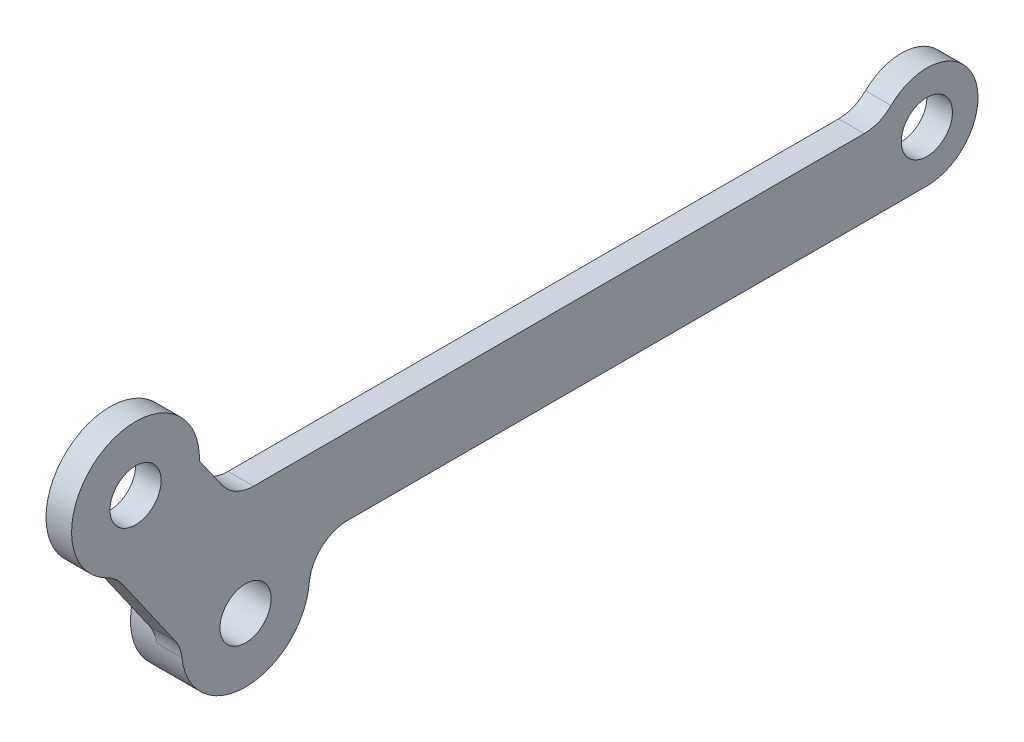
from build123d import *

# Parameters (mm, degrees)
EXTRUDE_1_DEPTH          = 2
EXTRUDE_START            = -2
SKETCH_1_4_R             = 5
EXTRUDE_2_DEPTH          = 2
CUT_EXTRUDE_1_DEPTH      = 60.733771951
CUT_EXTRUDE_1_DEPTH_BACK = 60.733771951
SKETCH_1_3_R             = 2
FILLET_1_R               = 3


with BuildPart() as part:
    # 草图1 → 凸台-拉伸1 (new body)
    with BuildSketch(Plane(origin=(0, 0, 0), x_dir=(0, 0, -1), z_dir=(1, 0, 0))):
        with BuildLine():
            Line((50.737143614, 0), (0, 0))
            Line((0, 0), (2.48051592, -3.542543867))
            ThreePointArc((2.48051592, -3.542543867), (4.165783411, -4.487079684), (5.367176995, -6))
            Line((5.367176995, -6), (54.201245229, -6))
            ThreePointArc((54.201245229, -6), (50.737143614, -4), (50.737143614, 0))
        make_face()
        with BuildLine():
            Line((2.48051592, -3.542543867), (0, 0))
            Line((0, 0), (-2.681672007, 3.829824531))
            ThreePointArc((-2.681672007, 3.829824531), (-4.811127311, -0.102785303), (-9.234888361, -0.758786959))
            Line((-9.234888361, -0.758786959), (-4.072700434, -8.131155358))
            ThreePointArc((-4.072700434, -8.131155358), (-1.94324513, -4.198545524), (2.48051592, -3.542543867))
        make_face()
        with BuildLine():
            ThreePointArc((58.201245229, -2), (55.23652141, 1.863703305), (50.737143614, 0))
            Line((50.737143614, 0), (54.201245229, 0))
            ThreePointArc((54.201245229, 0), (55.615458792, -0.585786438), (56.201245229, -2))
            ThreePointArc((56.201245229, -2), (55.615458792, -3.414213562), (54.201245229, -4))
            Line((54.201245229, -4), (54.201245229, -6))
            ThreePointArc((54.201245229, -6), (57.029672354, -4.828427125), (58.201245229, -2))
        make_face()
        with BuildLine():
            Line((54.201245229, 0), (50.737143614, 0))
            ThreePointArc((50.737143614, 0), (50.737143614, -4), (54.201245229, -6))
            Line((54.201245229, -6), (54.201245229, -4))
            ThreePointArc((54.201245229, -4), (52.201245229, -2), (54.201245229, 0))
        make_face()
        with BuildLine():
            ThreePointArc((5.367176995, -6), (4.165783411, -4.487079684), (2.48051592, -3.542543867))
            Line((2.48051592, -3.542543867), (4.201245229, -6))
            Line((4.201245229, -6), (5.367176995, -6))
        make_face()
        with BuildLine():
            Line((4.201245229, -6), (2.48051592, -3.542543867))
            ThreePointArc((2.48051592, -3.542543867), (-1.94324513, -4.198545524), (-4.072700434, -8.131155358))
            Line((-4.072700434, -8.131155358), (-2.351971125, -10.588611491))
            Line((-2.351971125, -10.588611491), (-0.713667036, -9.441458618))
            ThreePointArc((-0.713667036, -9.441458618), (-0.222515821, -6.656001657), (2.562941141, -7.147152873))
            Line((2.562941141, -7.147152873), (4.201245229, -6))
        make_face()
        with BuildLine():
            ThreePointArc((-9.234888361, -0.758786959), (-4.811127311, -0.102785303), (-2.681672007, 3.829824531))
            Line((-2.681672007, 3.829824531), (-4.402401316, 6.287280664))
            Line((-4.402401316, 6.287280664), (-6.040705405, 5.140127792))
            ThreePointArc((-6.040705405, 5.140127792), (-5.771575592, 4.594386518), (-5.679009493, 3.992974919))
            ThreePointArc((-5.679009493, 3.992974919), (-7.077597894, 2.085541017), (-9.317313582, 2.845822046))
            Line((-9.317313582, 2.845822046), (-10.95561767, 1.698669174))
            Line((-10.95561767, 1.698669174), (-9.234888361, -0.758786959))
        make_face()
        with BuildLine():
            Line((-4.402401316, 6.287280664), (-2.681672007, 3.829824531))
            ThreePointArc((-2.681672007, 3.829824531), (-2.679675166, 3.911388863), (-2.679009493, 3.992974919))
            ThreePointArc((-2.679009493, 3.992974919), (-10.613341245, 8.041394014), (-9.234888361, -0.758786959))
            Line((-9.234888361, -0.758786959), (-10.95561767, 1.698669174))
            Line((-10.95561767, 1.698669174), (-9.317313582, 2.845822046))
            ThreePointArc((-9.317313582, 2.845822046), (-8.826162366, 5.631279008), (-6.040705405, 5.140127792))
            Line((-6.040705405, 5.140127792), (-4.402401316, 6.287280664))
        make_face()
        with BuildLine():
            ThreePointArc((56.201245229, -2), (55.615458792, -0.585786438), (54.201245229, 0))
            Line((54.201245229, 0), (54.201245229, -4))
            ThreePointArc((54.201245229, -4), (55.615458792, -3.414213562), (56.201245229, -2))
        make_face()
        with BuildLine():
            Line((54.201245229, -4), (54.201245229, 0))
            ThreePointArc((54.201245229, 0), (52.201245229, -2), (54.201245229, -4))
        make_face()
        with BuildLine():
            Line((5.367176995, -6), (4.201245229, -6))
            Line((4.201245229, -6), (2.562941141, -7.147152873))
            ThreePointArc((2.562941141, -7.147152873), (2.832070954, -7.692894146), (2.924637052, -8.294305745))
            ThreePointArc((2.924637052, -8.294305745), (1.526048651, -10.201739647), (-0.713667036, -9.441458618))
            Line((-0.713667036, -9.441458618), (-2.351971125, -10.588611491))
            Line((-2.351971125, -10.588611491), (-4.072700434, -8.131155358))
            ThreePointArc((-4.072700434, -8.131155358), (0.843050996, -13.293640073), (5.924637052, -8.294305745))
            ThreePointArc((5.924637052, -8.294305745), (5.783273678, -7.113776143), (5.367176995, -6))
        make_face()
        with BuildLine():
            ThreePointArc((2.924637052, -8.294305745), (2.832070954, -7.692894146), (2.562941141, -7.147152873))
            Line((2.562941141, -7.147152873), (-0.713667036, -9.441458618))
            ThreePointArc((-0.713667036, -9.441458618), (1.526048651, -10.201739647), (2.924637052, -8.294305745))
        make_face()
        with BuildLine():
            Line((-0.713667036, -9.441458618), (2.562941141, -7.147152873))
            ThreePointArc((2.562941141, -7.147152873), (-0.222515821, -6.656001657), (-0.713667036, -9.441458618))
        make_face()
        with BuildLine():
            ThreePointArc((-5.679009493, 3.992974919), (-5.771575592, 4.594386518), (-6.040705405, 5.140127792))
            Line((-6.040705405, 5.140127792), (-9.317313582, 2.845822046))
            ThreePointArc((-9.317313582, 2.845822046), (-7.077597894, 2.085541017), (-5.679009493, 3.992974919))
        make_face()
        with BuildLine():
            Line((-9.317313582, 2.845822046), (-6.040705405, 5.140127792))
            ThreePointArc((-6.040705405, 5.140127792), (-8.826162366, 5.631279008), (-9.317313582, 2.845822046))
        make_face()
    extrude(amount=EXTRUDE_1_DEPTH)

    # 草图1<4> → 凸台-拉伸2 (add)
    with BuildSketch(Plane(origin=(0, 0, 0), x_dir=(0, 0, -1), z_dir=(1, 0, 0)).offset(EXTRUDE_START)):
        with Locations(Location((0.924637052, -8.294305745, 0), (0, 0, 178.130102354))):
            Circle(SKETCH_1_4_R)
    extrude(amount=EXTRUDE_2_DEPTH)

    # 草图1<3> → 切除-拉伸1 (cut, two sides: drawn at the far end of the back side and taken through both)
    with BuildSketch(Plane(origin=(0, 0, 0), x_dir=(0, 0, -1), z_dir=(1, 0, 0)).offset(-CUT_EXTRUDE_1_DEPTH_BACK)):
        with Locations((-7.679009493, 3.992974919)):
            Circle(SKETCH_1_3_R)
        with Locations((54.201245229, -2)):
            Circle(SKETCH_1_3_R)
        with Locations((0.924637052, -8.294305745)):
            Circle(SKETCH_1_3_R)
    extrude(amount=CUT_EXTRUDE_1_DEPTH + CUT_EXTRUDE_1_DEPTH_BACK, mode=Mode.SUBTRACT)

    # 圆角1
    # the kernel refuses this fillet: 3 mm, written as the material it adds along each edge
    with BuildSketch(Plane(origin=(0, -6, -5.367176995), x_dir=(0, 0, -1), z_dir=(1, 0, 0))) as fillet_1_piece_1:
        with BuildLine():
            CenterArc((3.526273997, -3), FILLET_1_R, 90, 84.939259464)
            ThreePointArc((0.53796877, -2.735364655), (0.463478447, -1.329430853), (0, 0))
            Line((0, 0), (3.526273997, 0))
        make_face()
    extrude(amount=2)
    with BuildSketch(Plane(origin=(0, 0, 0), x_dir=(0, 0, -1), z_dir=(1, 0, 0))) as fillet_1_piece_2:
        with BuildLine():
            CenterArc((FILLET_1_R * 0.520567050552, FILLET_1_R), FILLET_1_R, 215, 55)
            Line((-FILLET_1_R * 0.298584993737, FILLET_1_R * 0.426423563649), (0, 0))
            Line((0, 0), (FILLET_1_R * 0.520567050552, 0))
        make_face()
    extrude(amount=2)
    with BuildSketch(Plane(origin=(0, 0, -50.737143614), x_dir=(0, 0.7902368852402493, -0.6128014892326789), z_dir=(1, 0, 0))) as fillet_1_piece_3:
        with BuildLine():
            CenterArc((1.49141536, 2.972297887), FILLET_1_R, 217.792345701, 44.415308597)
            Line((-0.879295296, 1.133893419), (0, 0))
            ThreePointArc((0, 0), (0.542332858, 0.036936151), (1.084665716, 0))
        make_face()
    extrude(amount=2)
    with BuildSketch(Plane(origin=(0, -0.758786959, 9.234888361), x_dir=(0, -0.8191520442889745, -0.5735764363510707), z_dir=(1, 0, 0))) as fillet_1_piece_4:
        with BuildLine():
            CenterArc((0.872983346, -3), FILLET_1_R, 90, 28.955024372)
            ThreePointArc((-0.579385409, -0.375), (-0.283214788, -0.19750856), (0, 0))
            Line((0, 0), (0.872983346, 0))
        make_face()
    extrude(amount=2)
    with BuildSketch(Plane(origin=(0, -8.131155358, 4.072700434), x_dir=(0, -0.9993363396246481, -0.03642636827368134), z_dir=(1, 0, 0))) as fillet_1_piece_5:
        with BuildLine():
            CenterArc((0.897200113, -2.992846785), FILLET_1_R, 93.957436637, 28.955024372)
            Line((-0.732871014, -0.474341649), (0, 0))
            ThreePointArc((0, 0), (0.345076967, -0.011922025), (0.690153933, 0))
        make_face()
    extrude(amount=2)


solid = part.part
